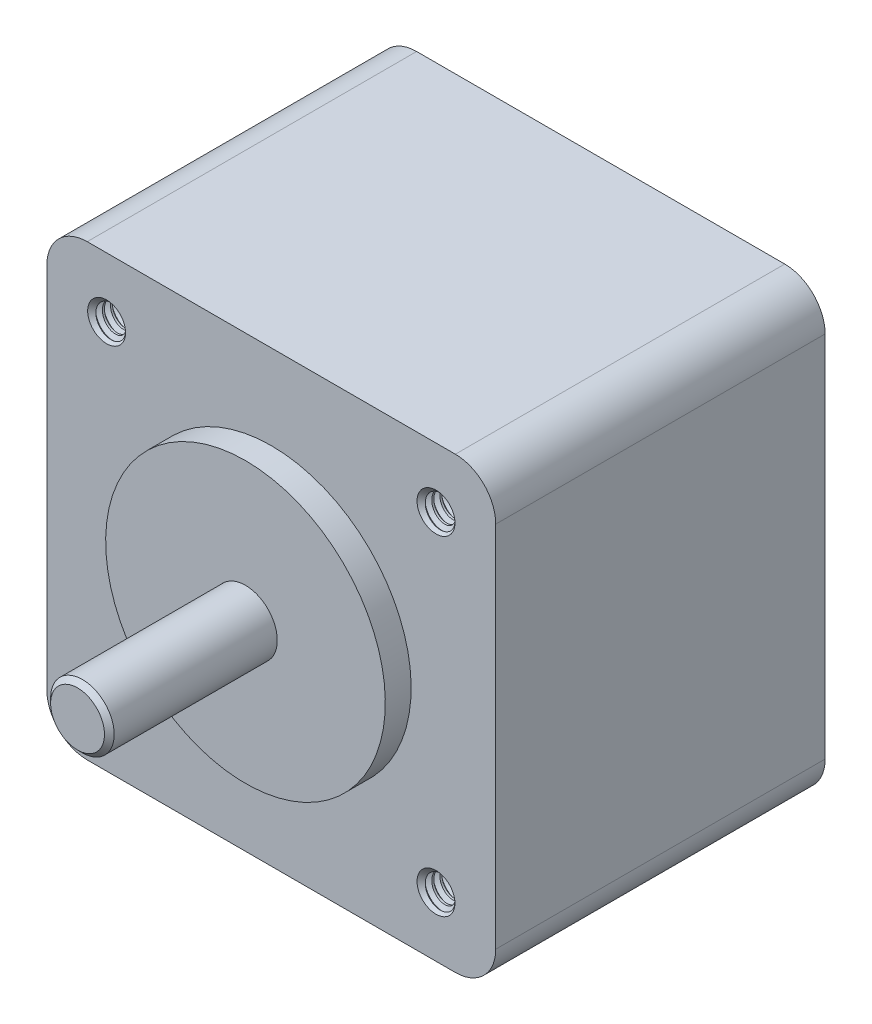
from build123d import *

# Parameters (mm, degrees)
BOSS_EXTRUDE1_DEPTH  = 25.908
SKETCH4_W            = 2.032
SKETCH4_H            = 10.9982
SKETCH5_W            = 27.94
SKETCH5_H            = 2.49936
SKETCH6_W            = 41.148
SKETCH6_H            = 2.49936
CHAMFER1_SIZE        = 0.381
SKETCH7_R            = 1.4224
CUT_EXTRUDE2_DEPTH   = 3.556
SWEEP1_PITCH         = 0.635
LPATTERN1_COUNT      = 2
LPATTERN1_PITCH      = 25.908
LPATTERN1_COUNT_DIR2 = 2
LPATTERN1_PITCH_DIR2 = 25.908


# Read off the part's stored shape, not the designer's step: Cut-Extrude3
with BuildPart() as part:
    # Sketch3 → Boss-Extrude1 (new body)
    with BuildSketch(Plane.XY):
        with BuildLine():
            Line((-17.653, -14.478), (-17.653, 14.478))
            ThreePointArc((-17.653, 14.478), (-16.72306403, 16.72306403), (-14.478, 17.653))
            Line((-14.478, 17.653), (14.478, 17.653))
            ThreePointArc((14.478, 17.653), (16.72306403, 16.72306403), (17.653, 14.478))
            Line((17.653, 14.478), (17.653, -14.478))
            ThreePointArc((17.653, -14.478), (16.72306403, -16.72306403), (14.478, -17.653))
            Line((14.478, -17.653), (-14.478, -17.653))
            ThreePointArc((-14.478, -17.653), (-16.72306403, -16.72306403), (-17.653, -14.478))
        make_face()
    extrude(amount=-BOSS_EXTRUDE1_DEPTH)

    # Sketch4 → Revolve1 (revolve)
    with BuildSketch(Plane(origin=(0, 0, 0), x_dir=(0, 0, -1), z_dir=(1, 0, 0))):
        with Locations((-1.016, 5.4991)):
            Rectangle(SKETCH4_W, SKETCH4_H)
    revolve(axis=Axis((0, 0, 0), (0, 0, 1)))

    # Sketch5 → Cut-Revolve1 (revolve, cut)
    with BuildSketch(Plane(origin=(0, 0, 0), x_dir=(0, 0, -1), z_dir=(1, 0, 0)), mode=Mode.PRIVATE) as cut_revolve1_sk:
        with Locations((11.938, 1.24968)):
            Rectangle(SKETCH5_W, SKETCH5_H)
    revolve(cut_revolve1_sk.sketch.rotate(Axis((0, 0, 15.24), (0, 0, -1)), 180), axis=Axis((0, 0, 15.24), (0, 0, -1)), mode=Mode.SUBTRACT)

    # Sketch7 → Cut-Extrude2 (cut)
    with BuildSketch(Plane.XY):
        with Locations((12.954, -12.954)):
            Circle(SKETCH7_R)
    cut_extrude2 = extrude(amount=-CUT_EXTRUDE2_DEPTH, mode=Mode.SUBTRACT)

    # Sweep1: the profile of Sketch9 screwed along a right-hand helix of 6.6 turns, 6 arcs to a turn; built about Z, then put on its axis
    sweep1_z = Axis((0, 0, 0), (0, 0, 1))
    sweep1_corners = [(1.456770383, 0, -0.57546875), (1.078696168, 0, -0.3571875), (1.078696168, 0, -0.1984375), (1.456770383, 0, 0.01984375)]
    with BuildLine(mode=Mode.PRIVATE) as sweep1_profile:
        Line(sweep1_corners[0], sweep1_corners[1])
        Line(sweep1_corners[1], sweep1_corners[2])
        Line(sweep1_corners[2], sweep1_corners[3])
        Line(sweep1_corners[3], sweep1_corners[0])
    sweep1_cap = Face(sweep1_profile.wire())
    sweep1_turn_angles = [0, 30, 60, 90, 120, 150, 180, 210, 240, 270, 300, 330, 360]
    sweep1_turn_weights = [1, 0.8660254037844387, 1, 0.8660254037844387, 1, 0.8660254037844387, 1, 0.8660254037844387, 1, 0.8660254037844387, 1, 0.8660254037844387, 1]
    sweep1_turn_rails = [Edge.make_bspline([Vector(p[0], p[1], 0).rotate(sweep1_z, sweep1_turn_angles[k]) / sweep1_turn_weights[k] + Vector(0, 0, p[2] + SWEEP1_PITCH * sweep1_turn_angles[k] / 360) for k in range(13)], [0, 0, 0, 1, 1, 2, 2, 3, 3, 4, 4, 5, 5, 6, 6, 6], 2, sweep1_turn_weights) for p in sweep1_corners]
    sweep1_turn_sides = [Face.make_surface_from_curves(sweep1_turn_rails[p[0]], sweep1_turn_rails[p[1]]) for p in [(0, 1), (1, 2), (2, 3), (3, 0)]]
    sweep1_last_angles = [2160, 2190, 2220, 2250, 2280, 2310, 2340, 2358, 2376]
    sweep1_last_weights = [1, 0.8660254037844387, 1, 0.8660254037844387, 1, 0.8660254037844387, 1, 0.9510565162951377, 1]
    sweep1_last_rails = [Edge.make_bspline([Vector(p[0], p[1], 0).rotate(sweep1_z, sweep1_last_angles[k]) / sweep1_last_weights[k] + Vector(0, 0, p[2] + SWEEP1_PITCH * sweep1_last_angles[k] / 360) for k in range(9)], [0, 0, 0, 1, 1, 2, 2, 3, 3, 4, 4, 4], 2, sweep1_last_weights) for p in sweep1_corners]
    sweep1_last_sides = [Face.make_surface_from_curves(sweep1_last_rails[p[0]], sweep1_last_rails[p[1]]) for p in [(0, 1), (1, 2), (2, 3), (3, 0)]]
    sweep1 = Plane(origin=(12.954, -12.954, 0), x_dir=(0, 1, 0), z_dir=(0, 0, -1)) * Solid(Shell([*[p.moved(Location((0, 0, SWEEP1_PITCH * i))) for i in range(6) for p in sweep1_turn_sides], *sweep1_last_sides, sweep1_cap, sweep1_cap.rotate(sweep1_z, 2376).moved(Location((0, 0, SWEEP1_PITCH * 2376 / 360)))]))
    add(sweep1)

    # Cut-Extrude3 outline → Cut-Extrude3 (revolve, cut)
    with BuildSketch(Plane(origin=(12.954, -12.954, 0), x_dir=(1, 0, 0), z_dir=(0, -1, 0))):
        Polygon((1.078693088, -0.412447678), (1.491140766, 0), (1.491140766, 0.57546885), (1.078693088, 0.57546885), align=None)
    cut_extrude3 = revolve(axis=Axis((12.954, -12.954, 0), (0, 0, 1)), mode=Mode.SUBTRACT)

    # LPattern1: Cut-Extrude2, Sweep1, Cut-Extrude3 2 × 2
    with Locations(*[(-i * LPATTERN1_PITCH, j * LPATTERN1_PITCH_DIR2, 0) for i in range(LPATTERN1_COUNT) for j in range(LPATTERN1_COUNT_DIR2) if (i, j) != (0, 0)]):
        add(cut_extrude2, mode=Mode.SUBTRACT)
        add(sweep1)
        add(cut_extrude3, mode=Mode.SUBTRACT)


with BuildPart() as body_2:
    # Sketch6 → Revolve2 (revolve)
    with BuildSketch(Plane(origin=(0, 0, 0), x_dir=(0, 0, -1), z_dir=(1, 0, 0)), mode=Mode.PRIVATE) as revolve2_sk:
        with Locations((5.334, 1.24968)):
            Rectangle(SKETCH6_W, SKETCH6_H)
    revolve(revolve2_sk.sketch.rotate(Axis((0, 0, 15.24), (0, 0, -1)), 180), axis=Axis((0, 0, 15.24), (0, 0, -1)))

    # Chamfer1
    chamfer1_edges = [body_2.edges().sort_by_distance(p)[0] for p in [
        (0, 2.49936, 15.24),
        (0, 2.49936, -25.908),
    ]]
    chamfer(chamfer1_edges, length=CHAMFER1_SIZE)


solid = Compound([part.part, body_2.part])
